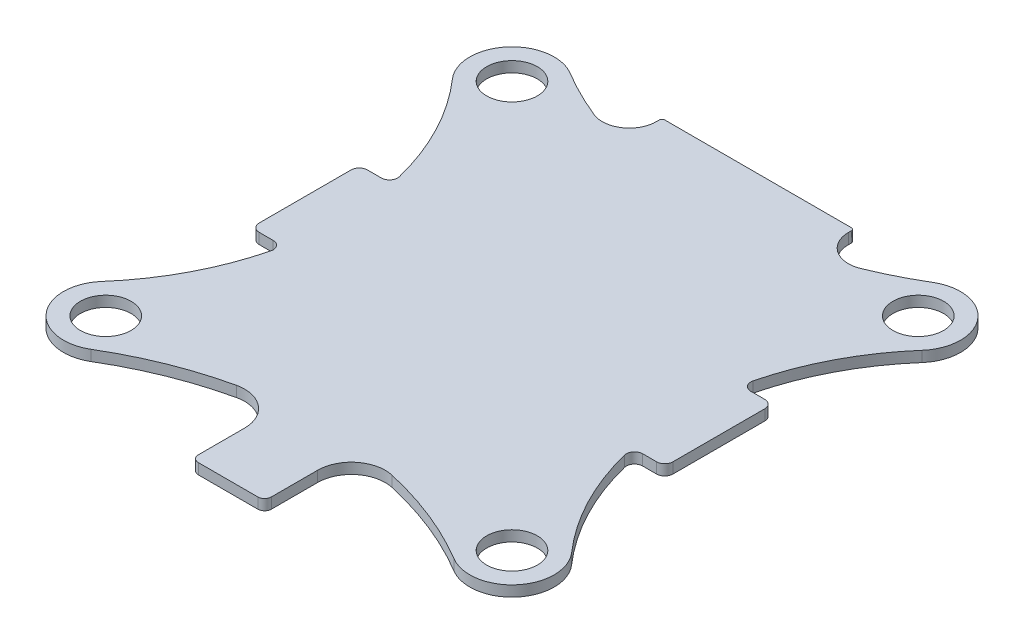
from build123d import *

# Parameters (mm, degrees)
SKETCH1_R           = 2.38125
BOSS_EXTRUDE2_DEPTH = 1


with BuildPart() as part:
    # Sketch1 → Boss-Extrude2 (new body)
    with BuildSketch(Plane(origin=(0, 0, 0), x_dir=(1, 0, 0), z_dir=(0, 1, 0))):
        with BuildLine():
            Line((-18.669, -5.08), (-17.351860811, -5.08))
            ThreePointArc((-17.351860811, -5.08), (-16.75159023, -5.372618247), (-16.6123436, -6.025734305))
            ThreePointArc((-16.6123436, -6.025734305), (-18.716150847, -11.572870926), (-22.068242673, -16.467787677))
            ThreePointArc((-22.068242673, -16.467787677), (-22.130718539, -21.625220104), (-17.045747414, -22.488979978))
            ThreePointArc((-17.045747414, -22.488979978), (-12.328853869, -20.153591651), (-7.302203786, -18.592850708))
            ThreePointArc((-7.302203786, -18.592850708), (-4.621094559, -19.210470135), (-3.429, -21.69012959))
            Line((-3.429, -21.69012959), (-3.429, -26.035))
            ThreePointArc((-3.429, -26.035), (-3.243012806, -26.484012806), (-2.794, -26.67))
            Line((-2.794, -26.67), (2.794, -26.67))
            ThreePointArc((2.794, -26.67), (3.243012806, -26.484012806), (3.429, -26.035))
            Line((3.429, -26.035), (3.429, -21.69012959))
            ThreePointArc((3.429, -21.69012959), (4.621094559, -19.210470135), (7.302203786, -18.592850708))
            ThreePointArc((7.302203786, -18.592850708), (12.328853869, -20.153591651), (17.045747414, -22.488979978))
            ThreePointArc((17.045747414, -22.488979978), (22.130718539, -21.625220104), (22.068242673, -16.467787677))
            ThreePointArc((22.068242673, -16.467787677), (18.716150847, -11.572870926), (16.6123436, -6.025734305))
            ThreePointArc((16.6123436, -6.025734305), (16.75159023, -5.372618247), (17.351860811, -5.08))
            Line((17.351860811, -5.08), (18.669, -5.08))
            ThreePointArc((18.669, -5.08), (19.207815367, -4.856815367), (19.431, -4.318))
            Line((19.431, -4.318), (19.431, 4.318))
            ThreePointArc((19.431, 4.318), (19.207815367, 4.856815367), (18.669, 5.08))
            Line((18.669, 5.08), (17.351860811, 5.08))
            ThreePointArc((17.351860811, 5.08), (16.75159023, 5.372618247), (16.6123436, 6.025734305))
            ThreePointArc((16.6123436, 6.025734305), (18.716150847, 11.572870926), (22.068242673, 16.467787677))
            ThreePointArc((22.068242673, 16.467787677), (22.130718539, 21.625220104), (17.045747414, 22.488979978))
            ThreePointArc((17.045747414, 22.488979978), (14.823153106, 21.272165027), (12.514244485, 20.228371436))
            ThreePointArc((12.514244485, 20.228371436), (10.13922022, 20.473602877), (9.017, 22.58108965))
            Line((9.017, 22.58108965), (9.017, 22.86))
            ThreePointArc((9.017, 22.86), (8.942605122, 23.039605122), (8.763, 23.114))
            Line((8.763, 23.114), (-8.763, 23.114))
            ThreePointArc((-8.763, 23.114), (-8.942605122, 23.039605122), (-9.017, 22.86))
            Line((-9.017, 22.86), (-9.017, 22.58108965))
            ThreePointArc((-9.017, 22.58108965), (-10.13922022, 20.473602877), (-12.514244485, 20.228371436))
            ThreePointArc((-12.514244485, 20.228371436), (-14.823153106, 21.272165027), (-17.045747414, 22.488979978))
            ThreePointArc((-17.045747414, 22.488979978), (-22.130718539, 21.625220104), (-22.068242673, 16.467787677))
            ThreePointArc((-22.068242673, 16.467787677), (-18.716150847, 11.572870926), (-16.6123436, 6.025734305))
            ThreePointArc((-16.6123436, 6.025734305), (-16.75159023, 5.372618247), (-17.351860811, 5.08))
            Line((-17.351860811, 5.08), (-18.669, 5.08))
            ThreePointArc((-18.669, 5.08), (-19.207815367, 4.856815367), (-19.431, 4.318))
            Line((-19.431, 4.318), (-19.431, -4.318))
            ThreePointArc((-19.431, -4.318), (-19.207815367, -4.856815367), (-18.669, -5.08))
        make_face()
        with Locations((-19.083044257, -19.083044257)):
            Circle(SKETCH1_R, mode=Mode.SUBTRACT)
        with Locations((19.083044257, -19.083044257)):
            Circle(SKETCH1_R, mode=Mode.SUBTRACT)
        with Locations((-19.083044257, 19.083044257)):
            Circle(SKETCH1_R, mode=Mode.SUBTRACT)
        with Locations((19.083044257, 19.083044257)):
            Circle(SKETCH1_R, mode=Mode.SUBTRACT)
    extrude(amount=BOSS_EXTRUDE2_DEPTH)


solid = part.part
